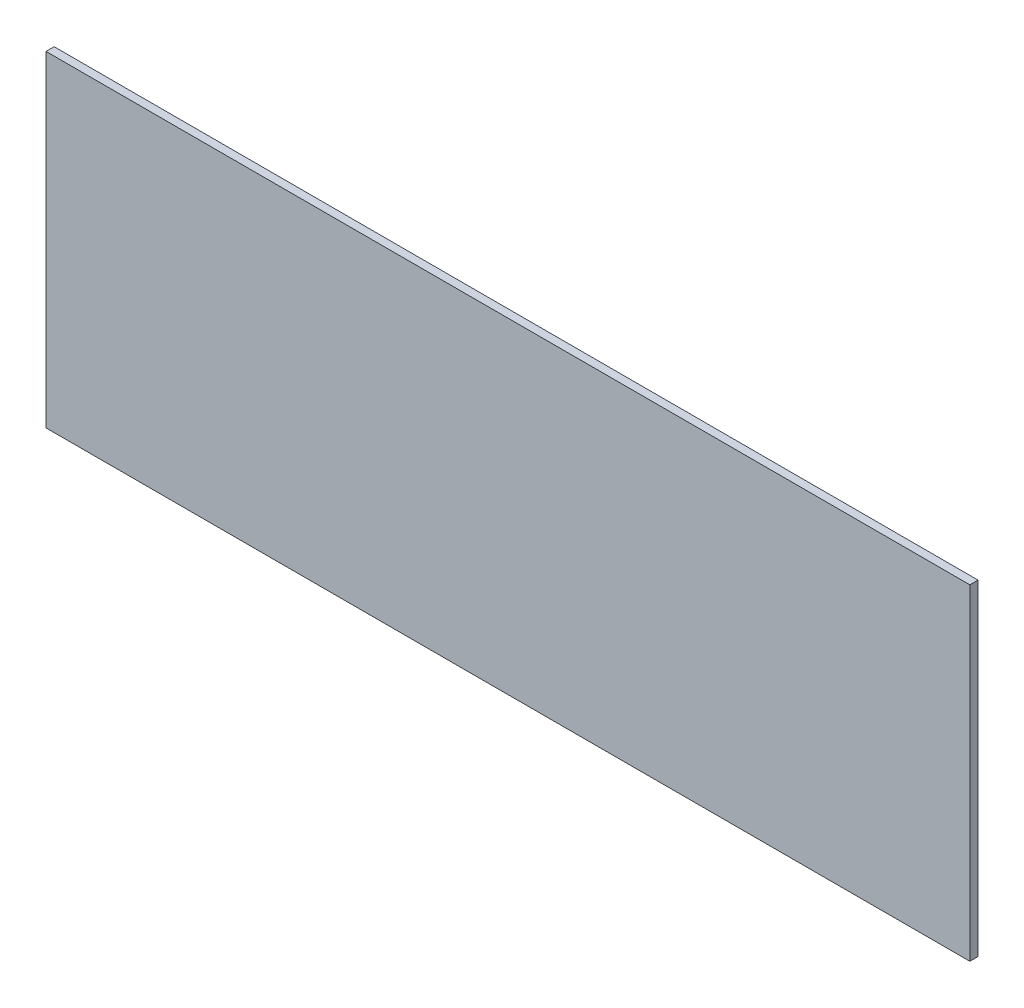
from build123d import *

# Parameters (mm, degrees)
CROQUIS1_W              = 170
CROQUIS1_H              = 60
SALIENTE_EXTRUIR1_DEPTH = 1.5


with BuildPart() as part:
    # Croquis1 → Saliente-Extruir1 (new body)
    with BuildSketch(Plane.XY):
        Rectangle(CROQUIS1_W, CROQUIS1_H)
    extrude(amount=SALIENTE_EXTRUIR1_DEPTH)


solid = part.part
